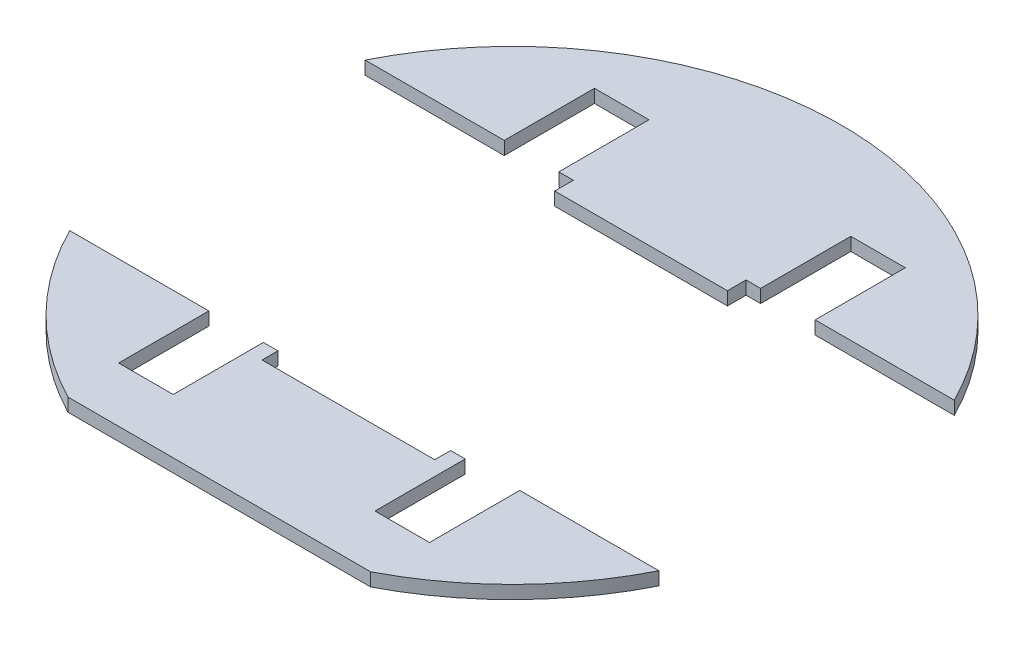
from build123d import *

# Parameters (mm, degrees)
BOSS_EXTRUDE1_DEPTH = 2.9
CUT_EXTRUDE1_DEPTH  = 103.571487266
SKETCH3_W           = 38.3
SKETCH3_H           = 65
CUT_EXTRUDE2_DEPTH  = 103.571487266


with BuildPart() as part:
    # Sketch1 → Boss-Extrude1 (new body)
    with BuildSketch(Plane(origin=(0, 0, 0), x_dir=(1, 0, 0), z_dir=(0, 1, 0))):
        with BuildLine():
            Line((-33.29110537, -64.404598464), (33.29110537, -64.404598464))
            ThreePointArc((33.29110537, -64.404598464), (0, 72.5), (-33.29110537, -64.404598464))
        make_face()
    extrude(amount=BOSS_EXTRUDE1_DEPTH)

    # Sketch2 → Cut-Extrude1 (cut, through all)
    with BuildSketch(Plane(origin=(0, 2.9, 0), x_dir=(1, 0, 0), z_dir=(0, 1, 0))):
        Polygon((-34.2, 52.344931419), (-34.2, -52.344931419), (-22.2, -52.344931419), (-22.2, -32.5), (-19, -32.5), (-19, -36), (-18, -36), (18, -36), (19, -36), (19, -32.5), (22.2, -32.5), (22.2, -52.344931419), (34.2, -52.344931419), (34.2, 52.344931419), (22.2, 52.344931419), (22.2, 32.5), (19, 32.5), (19, 28.4), (-19, 28.4), (-19, 32.5), (-22.2, 32.5), (-22.2, 52.344931419), align=None)
    extrude(amount=-CUT_EXTRUDE1_DEPTH, mode=Mode.SUBTRACT)

    # Sketch3 → Cut-Extrude2 (cut, through all)
    with BuildSketch(Plane(origin=(0, 2.9, 0), x_dir=(1, 0, 0), z_dir=(0, 1, 0))):
        with Locations((-53.35, 0)):
            Rectangle(SKETCH3_W, SKETCH3_H)
        with Locations((53.35, 0)):
            Rectangle(SKETCH3_W, SKETCH3_H)
    extrude(amount=-CUT_EXTRUDE2_DEPTH, mode=Mode.SUBTRACT)


with BuildPart() as cut_extrude2_piece_1:
    # of the separate pieces the step leaves, piece 1, a body of its own (cut_extrude2_pieces)
    add(part.part.solids().sort_by_distance((64.807406984, 0, -32.5))[0])


with BuildPart() as cut_extrude2_piece_2:
    # of the separate pieces the step leaves, piece 2, a body of its own (cut_extrude2_pieces)
    add(part.part.solids().sort_by_distance((-33.29110537, 0, 64.404598464))[0])


solid = Compound([cut_extrude2_piece_1.part, cut_extrude2_piece_2.part])
